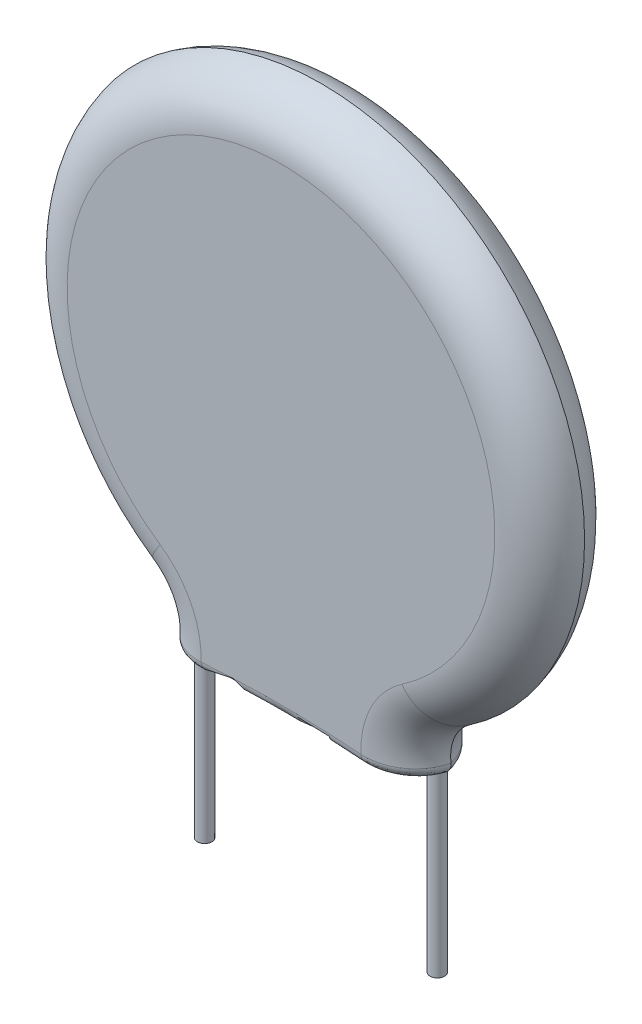
from build123d import *

# Parameters (mm, degrees)
BOSS_EXTRUDE1_DEPTH = 1.375
FILLET1_R           = 1.75
FILLET7_R           = 0.35
WRAP1_START         = -0.01
WRAP1_DEPTH         = 0.01


# Read off the part's stored shape, not the designer's step: Wrap1
with BuildPart() as part:
    # Sketch1 → Boss-Extrude1 (new, symmetric)
    with BuildSketch(Plane.XY):
        with BuildLine():
            ThreePointArc((4.65, -9.4), (4.54361032, -8.36096623), (5.144221582, -7.506462836))
            ThreePointArc((5.144221582, -7.506462836), (0, 9.1), (-5.144221582, -7.506462836))
            ThreePointArc((-5.144221582, -7.506462836), (-4.54361032, -8.36096623), (-4.65, -9.4))
            ThreePointArc((-4.65, -9.4), (0, -9.1), (4.65, -9.4))
        make_face()
    extrude(amount=BOSS_EXTRUDE1_DEPTH, both=True)

    # Fillet1
    # the kernel refuses this fillet: 1.75 mm, written as the material it takes off along each edge
    with BuildSketch(Plane(origin=(-5.988209995, -8.738013141, -1.375), x_dir=(0.5652990749851068, 0.8248860259581214, 0), z_dir=(-0.8248860259581214, 0.5652990749851068, 0))) as fillet1_piece_1:
        with BuildLine():
            CenterArc((1.492994505 + FILLET1_R, -FILLET1_R), FILLET1_R, 90, 90)
            Line((1.492994505 + FILLET1_R, 0), (1.492994505, 0))
            Line((1.492994505, 0), (1.492994505, -FILLET1_R))
        make_face()
    revolve(axis=Axis((-5.988209995, -8.738013141, -1.375), (0, 0, -1)), revolution_arc=249.850328298, mode=Mode.SUBTRACT)
    with BuildSketch(Plane(origin=(0, 0, -1.375), x_dir=(0.5652990749851083, -0.8248860259581203, 0), z_dir=(-0.8248860259581203, -0.5652990749851083, 0))) as fillet1_piece_2:
        with BuildLine():
            CenterArc((9.1 - FILLET1_R, FILLET1_R), FILLET1_R, 270, 90)
            Line((9.1 - FILLET1_R, 0), (9.1, 0))
            Line((9.1, 0), (9.1, FILLET1_R))
        make_face()
    revolve(axis=Axis((0, 0, -1.375), (0, 0, 1)), revolution_arc=291.153875626, mode=Mode.SUBTRACT)
    with BuildSketch(Plane(origin=(-5.988209995, -8.738013141, 1.375), x_dir=(0.5652990749851068, 0.8248860259581214, 0), z_dir=(-0.8248860259581214, 0.5652990749851068, 0))) as fillet1_piece_3:
        with BuildLine():
            CenterArc((1.492994505 + FILLET1_R, FILLET1_R), FILLET1_R, 180, 90)
            Line((1.492994505 + FILLET1_R, 0), (1.492994505, 0))
            Line((1.492994505, 0), (1.492994505, FILLET1_R))
        make_face()
    revolve(axis=Axis((-5.988209995, -8.738013141, 1.375), (0, 0, -1)), revolution_arc=249.850328298, mode=Mode.SUBTRACT)
    with BuildSketch(Plane(origin=(0, 0, 1.375), x_dir=(0.5652990749851083, -0.8248860259581203, 0), z_dir=(-0.8248860259581203, -0.5652990749851083, 0))) as fillet1_piece_4:
        with BuildLine():
            CenterArc((9.1 - FILLET1_R, -FILLET1_R), FILLET1_R, 0, 90)
            Line((9.1 - FILLET1_R, 0), (9.1, 0))
            Line((9.1, 0), (9.1, -FILLET1_R))
        make_face()
    revolve(axis=Axis((0, 0, 1.375), (0, 0, 1)), revolution_arc=291.153875626, mode=Mode.SUBTRACT)
    with BuildSketch(Plane(origin=(5.988209995, -8.738013141, -1.375), x_dir=(0.9691303390845691, 0.24654895227079748, 0), z_dir=(-0.24654895227079748, 0.9691303390845691, 0))) as fillet1_piece_5:
        with BuildLine():
            CenterArc((1.492994505 + FILLET1_R, -FILLET1_R), FILLET1_R, 90, 90)
            Line((1.492994505 + FILLET1_R, 0), (1.492994505, 0))
            Line((1.492994505, 0), (1.492994505, -FILLET1_R))
        make_face()
    revolve(axis=Axis((5.988209995, -8.738013141, -1.375), (0, 0, -1)), revolution_arc=249.850328298, mode=Mode.SUBTRACT)
    with BuildSketch(Plane(origin=(5.988209995, -8.738013141, 1.375), x_dir=(0.9691303390845691, 0.24654895227079748, 0), z_dir=(-0.24654895227079748, 0.9691303390845691, 0))) as fillet1_piece_6:
        with BuildLine():
            CenterArc((1.492994505 + FILLET1_R, FILLET1_R), FILLET1_R, 180, 90)
            Line((1.492994505, FILLET1_R), (1.492994505, 0))
            Line((1.492994505, 0), (1.492994505 + FILLET1_R, 0))
        make_face()
    revolve(axis=Axis((5.988209995, -8.738013141, 1.375), (0, 0, -1)), revolution_arc=249.850328298, mode=Mode.SUBTRACT)

    # Fillet7
    fillet7_edges = [part.edges().sort_by_distance(p)[0] for p in [
        (0, -9.1, -1.375),
        (0, -9.1, 1.375),
        (3.918729767, -9.312804543, 0.989952098),
        (3.918729762, -9.312804542, -0.989952103),
        (-3.918729767, -9.312804543, 0.989952098),
        (-3.918729762, -9.312804542, -0.989952103),
    ]]
    fillet(fillet7_edges, radius=FILLET7_R)

    # Wrap1 outline → Wrap1 (cut)
    # profile 1 of 7: a face of its own
    with BuildSketch(Plane(origin=(0, 0, -1.375), x_dir=(-1, 0, 0), z_dir=(0, 0, -1)).offset(WRAP1_START)):
        with BuildLine():
            Line((-3.405877976, 1.0390625), (-3.506324405, 0.931547619))
            add(Edge.make_bspline(
                [(-3.506324405, 0.931547619), (-3.510771743, 0.924253302), (-3.52084471, 0.907732087), (-3.522747076, 0.888400579), (-3.523809524, 0.877604167)],
                knots=[0, 0, 0, 0, 0.441512162, 1, 1, 1, 1], degree=3))
            Line((-3.523809524, 0.877604167), (-3.5234375, 0.857886905))
            add(Edge.make_bspline(
                [(-3.5234375, 0.857886905), (-3.518094179, 0.844321571), (-3.506013831, 0.813652635), (-3.474209827, 0.803359419), (-3.456473214, 0.797619048)],
                knots=[0, 0, 0, 0, 0.442315111, 1, 1, 1, 1], degree=3))
            Line((-3.456473214, 0.797619048), (-2.642857143, 0.797619048))
            Line((-2.642857143, 0.797619048), (-2.642857143, 0.272693452))
            add(Edge.make_bspline(
                [(-2.642857143, 0.272693452), (-2.639234132, 0.253384522), (-2.630990314, 0.209448877), (-2.585193656, 0.20491966), (-2.55952381, 0.202380952)],
                knots=[0, 0, 0, 0, 0.439482114, 1, 1, 1, 1], degree=3))
            add(Edge.make_bspline(
                [(-2.55952381, 0.202380952), (-2.539318487, 0.205000694), (-2.494231769, 0.210846458), (-2.467263542, 0.248063001), (-2.452380952, 0.26860119)],
                knots=[0, 0, 0, 0, 0.448143547, 1, 1, 1, 1], degree=3))
            Line((-2.452380952, 0.26860119), (-2.452380952, 0.797619048))
            Line((-2.452380952, 0.797619048), (-2.09858631, 0.797619048))
            Line((-2.09858631, 0.797619048), (-2.059151786, 0.813616071))
            add(Edge.make_bspline(
                [(-2.059151786, 0.813616071), (-2.048705584, 0.823203954), (-2.024997845, 0.844963728), (-2.022088646, 0.877346929), (-2.02046131, 0.89546131)],
                knots=[0, 0, 0, 0, 0.440624151, 1, 1, 1, 1], degree=3))
            add(Edge.make_bspline(
                [(-2.02046131, 0.89546131), (-2.026538921, 0.912107085), (-2.040424791, 0.950138649), (-2.080748128, 0.958955709), (-2.103422619, 0.96391369)],
                knots=[0, 0, 0, 0, 0.43768318, 1, 1, 1, 1], degree=3))
            Line((-2.103422619, 0.96391369), (-2.452380952, 0.964285714))
            Line((-2.452380952, 0.964285714), (-2.452380952, 2.12983631))
            Line((-2.452380952, 2.12983631), (-2.464285714, 2.157738095))
            add(Edge.make_bspline(
                [(-2.464285714, 2.157738095), (-2.471912668, 2.167725264), (-2.489394952, 2.190617562), (-2.518064332, 2.195761123), (-2.53422619, 2.198660714)],
                knots=[0, 0, 0, 0, 0.436267614, 1, 1, 1, 1], degree=3))
            add(Edge.make_bspline(
                [(-2.53422619, 2.198660714), (-2.537397116, 2.199492453), (-2.54459904, 2.20138153), (-2.552021282, 2.202022304), (-2.556175595, 2.202380952)],
                knots=[0, 0, 0, 0, 0.440288683, 1, 1, 1, 1], degree=3))
            add(Edge.make_bspline(
                [(-2.556175595, 2.202380952), (-2.565494264, 2.201082535), (-2.586693412, 2.19812875), (-2.604328314, 2.185833812), (-2.61421131, 2.178943452)],
                knots=[0, 0, 0, 0, 0.439577531, 1, 1, 1, 1], degree=3))
            Line((-2.61421131, 2.178943452), (-3.405877976, 1.0390625))
        make_face()
        Polygon((-2.642857143, 1.921875), (-2.642857143, 0.964285714), (-3.287574405, 0.964285714), align=None, mode=Mode.SUBTRACT)
    # profile 2 of 7: a face of its own
    with BuildSketch(Plane(origin=(0, 0, -1.375), x_dir=(-1, 0, 0), z_dir=(0, 0, -1)).offset(WRAP1_START)):
        with BuildLine():
            Line((0.928571429, -0.395089286), (1.640997024, -2.248139881))
            add(Edge.make_bspline(
                [(1.640997024, -2.248139881), (1.647308346, -2.260858798), (1.66156507, -2.289589717), (1.693746528, -2.294745617), (1.711681548, -2.297619048)],
                knots=[0, 0, 0, 0, 0.44269091, 1, 1, 1, 1], degree=3))
            add(Edge.make_bspline(
                [(1.711681548, -2.297619048), (1.72906646, -2.296816711), (1.768297032, -2.295006168), (1.795972668, -2.26657566), (1.811383929, -2.250744048)],
                knots=[0, 0, 0, 0, 0.443147037, 1, 1, 1, 1], degree=3))
            Line((1.811383929, -2.250744048), (2.523809524, -0.389136905))
            add(Edge.make_bspline(
                [(2.523809524, -0.389136905), (2.52360421, -0.382404249), (2.523138145, -0.367121051), (2.519036072, -0.352373106), (2.516741071, -0.344122024)],
                knots=[0, 0, 0, 0, 0.44052667, 1, 1, 1, 1], degree=3))
            add(Edge.make_bspline(
                [(2.516741071, -0.344122024), (2.505579268, -0.332673805), (2.4801106, -0.306551605), (2.443774609, -0.300832), (2.423363095, -0.297619048)],
                knots=[0, 0, 0, 0, 0.438256296, 1, 1, 1, 1], degree=3))
            add(Edge.make_bspline(
                [(2.423363095, -0.297619048), (2.411382539, -0.300012814), (2.384263898, -0.305431236), (2.364709974, -0.32524766), (2.353794643, -0.336309524)],
                knots=[0, 0, 0, 0, 0.441783061, 1, 1, 1, 1], degree=3))
            Line((2.353794643, -0.336309524), (1.725074405, -2.045386905))
            Line((1.725074405, -2.045386905), (1.102678571, -0.345610119))
            add(Edge.make_bspline(
                [(1.102678571, -0.345610119), (1.091119569, -0.334433258), (1.064831844, -0.309014607), (1.028764617, -0.301711114), (1.008556548, -0.297619048)],
                knots=[0, 0, 0, 0, 0.43971102, 1, 1, 1, 1], degree=3))
            add(Edge.make_bspline(
                [(1.008556548, -0.297619048), (0.998432776, -0.299407741), (0.975385693, -0.303479756), (0.956593816, -0.317601996), (0.946056548, -0.325520833)],
                knots=[0, 0, 0, 0, 0.439264753, 1, 1, 1, 1], degree=3))
            add(Edge.make_bspline(
                [(0.946056548, -0.325520833), (0.940937244, -0.334997611), (0.929270063, -0.356595722), (0.928822571, -0.381251771), (0.928571429, -0.395089286)],
                knots=[0, 0, 0, 0, 0.438778094, 1, 1, 1, 1], degree=3))
        make_face()
    # profile 3 of 7: a face of its own
    with BuildSketch(Plane(origin=(0, 0, -1.375), x_dir=(-1, 0, 0), z_dir=(0, 0, -1)).offset(WRAP1_START)):
        with BuildLine():
            Line((-0.785714286, -1.449032738), (-0.785714286, -0.366815476))
            add(Edge.make_bspline(
                [(-0.785714286, -0.366815476), (-0.79519786, -0.348256433), (-0.81696731, -0.305654339), (-0.865478958, -0.300517877), (-0.892857143, -0.297619048)],
                knots=[0, 0, 0, 0, 0.435636873, 1, 1, 1, 1], degree=3))
            add(Edge.make_bspline(
                [(-0.892857143, -0.297619048), (-0.911346879, -0.298688184), (-0.95268093, -0.301078252), (-0.967822244, -0.340541064), (-0.976190476, -0.36235119)],
                knots=[0, 0, 0, 0, 0.447324562, 1, 1, 1, 1], degree=3))
            Line((-0.976190476, -0.36235119), (-0.976190476, -2.226190476))
            add(Edge.make_bspline(
                [(-0.976190476, -2.226190476), (-0.971803093, -2.24485099), (-0.961827502, -2.287279393), (-0.917621065, -2.293906577), (-0.892857143, -2.297619048)],
                knots=[0, 0, 0, 0, 0.439811847, 1, 1, 1, 1], degree=3))
            Line((-0.892857143, -2.297619048), (-0.858630952, -2.297619048))
            add(Edge.make_bspline(
                [(-0.858630952, -2.297619048), (-0.844546159, -2.291434274), (-0.812777933, -2.277484526), (-0.795391983, -2.247161639), (-0.785714286, -2.230282738)],
                knots=[0, 0, 0, 0, 0.443361007, 1, 1, 1, 1], degree=3))
            Line((-0.785714286, -2.230282738), (-0.785714286, -1.632440476))
            Line((-0.785714286, -1.632440476), (-0.450892857, -1.27827381))
            Line((-0.450892857, -1.27827381), (0.269717262, -2.261904762))
            add(Edge.make_bspline(
                [(0.269717262, -2.261904762), (0.27971902, -2.271965965), (0.302506095, -2.294888472), (0.335122363, -2.296637633), (0.353422619, -2.297619048)],
                knots=[0, 0, 0, 0, 0.438922434, 1, 1, 1, 1], degree=3))
            add(Edge.make_bspline(
                [(0.353422619, -2.297619048), (0.373175408, -2.293671513), (0.417098243, -2.284893668), (0.431698081, -2.241748217), (0.439732143, -2.218005952)],
                knots=[0, 0, 0, 0, 0.449715703, 1, 1, 1, 1], degree=3))
            add(Edge.make_bspline(
                [(0.439732143, -2.218005952), (0.438538582, -2.21290242), (0.435827168, -2.201308713), (0.430221432, -2.190786297), (0.427083333, -2.184895833)],
                knots=[0, 0, 0, 0, 0.440198566, 1, 1, 1, 1], degree=3))
            Line((0.427083333, -2.184895833), (-0.335193452, -1.171502976))
            Line((-0.335193452, -1.171502976), (0.366071429, -0.474702381))
            Line((0.366071429, -0.474702381), (0.42671131, -0.411830357))
            add(Edge.make_bspline(
                [(0.42671131, -0.411830357), (0.429907307, -0.407239301), (0.437135694, -0.396855711), (0.438802376, -0.384259178), (0.439732143, -0.377232143)],
                knots=[0, 0, 0, 0, 0.442145323, 1, 1, 1, 1], degree=3))
            add(Edge.make_bspline(
                [(0.439732143, -0.377232143), (0.438690898, -0.370352545), (0.436322271, -0.354702812), (0.428732491, -0.340769538), (0.424479167, -0.33296131)],
                knots=[0, 0, 0, 0, 0.439598435, 1, 1, 1, 1], degree=3))
            add(Edge.make_bspline(
                [(0.424479167, -0.33296131), (0.415672627, -0.324532905), (0.395634579, -0.305355252), (0.36810766, -0.300636163), (0.352678571, -0.297991071)],
                knots=[0, 0, 0, 0, 0.439490913, 1, 1, 1, 1], degree=3))
            add(Edge.make_bspline(
                [(0.352678571, -0.297991071), (0.342905489, -0.297906513), (0.320798852, -0.297715242), (0.300427769, -0.306488965), (0.2890625, -0.311383929)],
                knots=[0, 0, 0, 0, 0.442088143, 1, 1, 1, 1], degree=3))
            Line((0.2890625, -0.311383929), (-0.785714286, -1.449032738))
        make_face()
    # profile 4 of 7: a face of its own
    with BuildSketch(Plane(origin=(0, 0, -1.375), x_dir=(-1, 0, 0), z_dir=(0, 0, -1)).offset(WRAP1_START)):
        with BuildLine():
            add(Edge.make_bspline(
                [(-1.714285714, 2.119047619), (-1.714302628, 2.114377128), (-1.714340963, 2.103791262), (-1.711680254, 2.09353103), (-1.710193452, 2.087797619)],
                knots=[0, 0, 0, 0, 0.441200688, 1, 1, 1, 1], degree=3))
            add(Edge.make_bspline(
                [(-1.710193452, 2.087797619), (-1.705490813, 2.07579409), (-1.694818488, 2.048552888), (-1.66626778, 2.040319644), (-1.650297619, 2.035714286)],
                knots=[0, 0, 0, 0, 0.440638716, 1, 1, 1, 1], degree=3))
            Line((-1.650297619, 2.035714286), (-0.516369048, 2.035714286))
            Line((-0.516369048, 2.035714286), (-1.363095238, 0.297619048))
            add(Edge.make_bspline(
                [(-1.363095238, 0.297619048), (-1.363153051, 0.29001818), (-1.363284013, 0.272800044), (-1.358388932, 0.256261493), (-1.355654762, 0.24702381)],
                knots=[0, 0, 0, 0, 0.441445415, 1, 1, 1, 1], degree=3))
            add(Edge.make_bspline(
                [(-1.355654762, 0.24702381), (-1.348370683, 0.235547151), (-1.331887873, 0.209577143), (-1.301059098, 0.204958517), (-1.283854167, 0.202380952)],
                knots=[0, 0, 0, 0, 0.441919713, 1, 1, 1, 1], degree=3))
            add(Edge.make_bspline(
                [(-1.283854167, 0.202380952), (-1.268239841, 0.202576117), (-1.23320466, 0.203014024), (-1.208108076, 0.227977572), (-1.194196429, 0.241815476)],
                knots=[0, 0, 0, 0, 0.445675624, 1, 1, 1, 1], degree=3))
            Line((-1.194196429, 0.241815476), (-0.383556548, 2.083333333))
            add(Edge.make_bspline(
                [(-0.383556548, 2.083333333), (-0.372977533, 2.088884466), (-0.348936754, 2.101499399), (-0.323909807, 2.112033129), (-0.309895833, 2.117931548)],
                knots=[0, 0, 0, 0, 0.440044614, 1, 1, 1, 1], degree=3))
            add(Edge.make_bspline(
                [(-0.309895833, 2.117931548), (-0.31078592, 2.12355604), (-0.312808992, 2.136339916), (-0.316903418, 2.148625583), (-0.319196429, 2.155505952)],
                knots=[0, 0, 0, 0, 0.439967736, 1, 1, 1, 1], degree=3))
            add(Edge.make_bspline(
                [(-0.319196429, 2.155505952), (-0.330889677, 2.167665899), (-0.357629512, 2.195472968), (-0.396360639, 2.199655439), (-0.418154762, 2.202008929)],
                knots=[0, 0, 0, 0, 0.437296954, 1, 1, 1, 1], degree=3))
            Line((-0.418154762, 2.202008929), (-1.643229167, 2.199404762))
            add(Edge.make_bspline(
                [(-1.643229167, 2.199404762), (-1.661682947, 2.19565972), (-1.703768051, 2.187118895), (-1.710503611, 2.143525736), (-1.714285714, 2.119047619)],
                knots=[0, 0, 0, 0, 0.438487212, 1, 1, 1, 1], degree=3))
        make_face()
    # profile 5 of 7: a face of its own
    with BuildSketch(Plane(origin=(0, 0, -1.375), x_dir=(-1, 0, 0), z_dir=(0, 0, -1)).offset(WRAP1_START)):
        with BuildLine():
            Line((0.285714286, 1.314732143), (0.285714286, 1.514136905))
            add(Edge.make_bspline(
                [(0.285714286, 1.514136905), (0.282288668, 1.523140345), (0.274456352, 1.543725771), (0.257853291, 1.558359105), (0.248511905, 1.566592262)],
                knots=[0, 0, 0, 0, 0.43736965, 1, 1, 1, 1], degree=3))
            add(Edge.make_bspline(
                [(0.248511905, 1.566592262), (0.238932661, 1.57156837), (0.217114675, 1.582902109), (0.192422461, 1.583178367), (0.178571429, 1.583333333)],
                knots=[0, 0, 0, 0, 0.439052626, 1, 1, 1, 1], degree=3))
            add(Edge.make_bspline(
                [(0.178571429, 1.583333333), (0.160081692, 1.582264197), (0.118747641, 1.579874129), (0.103606327, 1.540411317), (0.095238095, 1.51860119)],
                knots=[0, 0, 0, 0, 0.447324562, 1, 1, 1, 1], degree=3))
            Line((0.095238095, 1.51860119), (0.095238095, 0.273809524))
            add(Edge.make_bspline(
                [(0.095238095, 0.273809524), (0.099625478, 0.25514901), (0.109601069, 0.212720607), (0.153807506, 0.206093423), (0.178571429, 0.202380952)],
                knots=[0, 0, 0, 0, 0.439811847, 1, 1, 1, 1], degree=3))
            Line((0.178571429, 0.202380952), (0.212797619, 0.202380952))
            add(Edge.make_bspline(
                [(0.212797619, 0.202380952), (0.226717323, 0.208524845), (0.258125426, 0.222387784), (0.275846811, 0.252072432), (0.285714286, 0.26860119)],
                knots=[0, 0, 0, 0, 0.443188324, 1, 1, 1, 1], degree=3))
            Line((0.285714286, 0.26860119), (0.285714286, 1.123511905))
            Line((0.285714286, 1.123511905), (0.513020833, 1.347842262))
            Line((0.513020833, 1.347842262), (0.652529762, 1.416666667))
            Line((0.652529762, 1.416666667), (0.875, 1.416666667))
            Line((0.875, 1.416666667), (1.004092262, 1.352306548))
            Line((1.004092262, 1.352306548), (1.080357143, 1.141369048))
            Line((1.080357143, 1.141369048), (1.08296131, 0.27046131))
            add(Edge.make_bspline(
                [(1.08296131, 0.27046131), (1.090447465, 0.249964434), (1.107636184, 0.202902217), (1.159160163, 0.202569028), (1.188244048, 0.202380952)],
                knots=[0, 0, 0, 0, 0.435527199, 1, 1, 1, 1], degree=3))
            add(Edge.make_bspline(
                [(1.188244048, 0.202380952), (1.202714044, 0.206592228), (1.235009967, 0.215991471), (1.252099867, 0.245335904), (1.261532738, 0.261532738)],
                knots=[0, 0, 0, 0, 0.448044066, 1, 1, 1, 1], degree=3))
            Line((1.261532738, 0.261532738), (1.261904762, 1.163318452))
            add(Edge.make_bspline(
                [(1.261904762, 1.163318452), (1.248370667, 1.199921557), (1.217611879, 1.283109034), (1.188293228, 1.366815483), (1.171875, 1.413690476)],
                knots=[0, 0, 0, 0, 0.440007395, 1, 1, 1, 1], degree=3))
            add(Edge.make_bspline(
                [(1.171875, 1.413690476), (1.167997438, 1.427227358), (1.159191382, 1.457970007), (1.131067501, 1.473945747), (1.115327381, 1.482886905)],
                knots=[0, 0, 0, 0, 0.440329044, 1, 1, 1, 1], degree=3))
            Line((1.115327381, 1.482886905), (0.918526786, 1.579985119))
            Line((0.918526786, 1.579985119), (0.613839286, 1.58296131))
            Line((0.613839286, 1.58296131), (0.596354167, 1.578869048))
            Line((0.596354167, 1.578869048), (0.3984375, 1.483630952))
            Line((0.3984375, 1.483630952), (0.285714286, 1.314732143))
        make_face()
    # profile 6 of 7: a face of its own
    with BuildSketch(Plane(origin=(0, 0, -1.375), x_dir=(-1, 0, 0), z_dir=(0, 0, -1)).offset(WRAP1_START)):
        with BuildLine():
            Line((1.916666667, 0.202380952), (1.950892857, 0.202380952))
            add(Edge.make_bspline(
                [(1.950892857, 0.202380952), (1.964812561, 0.208524845), (1.996220664, 0.222387784), (2.013942049, 0.252072432), (2.023809524, 0.26860119)],
                knots=[0, 0, 0, 0, 0.443188324, 1, 1, 1, 1], degree=3))
            Line((2.023809524, 0.26860119), (2.023809524, 1.154761905))
            Line((2.023809524, 1.154761905), (2.62983631, 1.154761905))
            add(Edge.make_bspline(
                [(2.62983631, 1.154761905), (2.642909556, 1.15654097), (2.672634586, 1.160586082), (2.694323317, 1.181651603), (2.706473214, 1.193452381)],
                knots=[0, 0, 0, 0, 0.439805989, 1, 1, 1, 1], degree=3))
            add(Edge.make_bspline(
                [(2.706473214, 1.193452381), (2.710355516, 1.200153845), (2.719141393, 1.215319654), (2.721039078, 1.232802175), (2.722098214, 1.242559524)],
                knots=[0, 0, 0, 0, 0.441879805, 1, 1, 1, 1], degree=3))
            add(Edge.make_bspline(
                [(2.722098214, 1.242559524), (2.717481108, 1.259003585), (2.706905293, 1.29666989), (2.670459928, 1.312506043), (2.649925595, 1.321428571)],
                knots=[0, 0, 0, 0, 0.436572178, 1, 1, 1, 1], degree=3))
            Line((2.649925595, 1.321428571), (2.023809524, 1.321428571))
            Line((2.023809524, 1.321428571), (2.023809524, 2.035714286))
            Line((2.023809524, 2.035714286), (3.052455357, 2.035714286))
            add(Edge.make_bspline(
                [(3.052455357, 2.035714286), (3.063126766, 2.035645542), (3.087177718, 2.035490608), (3.108611887, 2.046630346), (3.120535714, 2.052827381)],
                knots=[0, 0, 0, 0, 0.443700072, 1, 1, 1, 1], degree=3))
            add(Edge.make_bspline(
                [(3.120535714, 2.052827381), (3.13115188, 2.062238387), (3.155219877, 2.083574157), (3.158744398, 2.115875208), (3.160714286, 2.133928571)],
                knots=[0, 0, 0, 0, 0.441090537, 1, 1, 1, 1], degree=3))
            add(Edge.make_bspline(
                [(3.160714286, 2.133928571), (3.154633366, 2.14847796), (3.140676199, 2.181872289), (3.105684092, 2.193080048), (3.0859375, 2.199404762)],
                knots=[0, 0, 0, 0, 0.435684404, 1, 1, 1, 1], degree=3))
            Line((3.0859375, 2.199404762), (1.899925595, 2.202380952))
            add(Edge.make_bspline(
                [(1.899925595, 2.202380952), (1.88676116, 2.198115428), (1.857049129, 2.188488173), (1.841816744, 2.160852509), (1.833333333, 2.14546131)],
                knots=[0, 0, 0, 0, 0.443067479, 1, 1, 1, 1], degree=3))
            Line((1.833333333, 2.14546131), (1.833333333, 0.273809524))
            add(Edge.make_bspline(
                [(1.833333333, 0.273809524), (1.837720716, 0.25514901), (1.847696307, 0.212720607), (1.891902744, 0.206093423), (1.916666667, 0.202380952)],
                knots=[0, 0, 0, 0, 0.439811847, 1, 1, 1, 1], degree=3))
        make_face()
    # profile 7 of 7: a face of its own
    with BuildSketch(Plane(origin=(0, 0, -1.375), x_dir=(-1, 0, 0), z_dir=(0, 0, -1)).offset(WRAP1_START)):
        with BuildLine():
            add(Edge.make_bspline(
                [(-2.436383929, -0.373511905), (-2.450984468, -0.380075262), (-2.484211886, -0.395011931), (-2.51030059, -0.420568908), (-2.524925595, -0.434895833)],
                knots=[0, 0, 0, 0, 0.439412387, 1, 1, 1, 1], degree=3))
            add(Edge.make_bspline(
                [(-2.524925595, -0.434895833), (-2.535772784, -0.445717274), (-2.560425115, -0.47031109), (-2.584172089, -0.495781424), (-2.597470238, -0.510044643)],
                knots=[0, 0, 0, 0, 0.440006596, 1, 1, 1, 1], degree=3))
            add(Edge.make_bspline(
                [(-2.597470238, -0.510044643), (-2.612340988, -0.539549008), (-2.646138089, -0.60660427), (-2.679329501, -0.673961531), (-2.697916667, -0.711681548)],
                knots=[0, 0, 0, 0, 0.440000746, 1, 1, 1, 1], degree=3))
            add(Edge.make_bspline(
                [(-2.697916667, -0.711681548), (-2.698074902, -0.719985221), (-2.698434518, -0.738856785), (-2.699771908, -0.757685353), (-2.700520833, -0.768229167)],
                knots=[0, 0, 0, 0, 0.44000979, 1, 1, 1, 1], degree=3))
            add(Edge.make_bspline(
                [(-2.700520833, -0.768229167), (-2.698565473, -0.771409619), (-2.694366004, -0.778240179), (-2.698377287, -0.785293404), (-2.700520833, -0.7890625)],
                knots=[0, 0, 0, 0, 0.465620921, 1, 1, 1, 1], degree=3))
            add(Edge.make_bspline(
                [(-2.700520833, -0.7890625), (-2.700289291, -0.804297833), (-2.699768115, -0.838590927), (-2.678491022, -0.865820206), (-2.666666667, -0.880952381)],
                knots=[0, 0, 0, 0, 0.444268247, 1, 1, 1, 1], degree=3))
            add(Edge.make_bspline(
                [(-2.666666667, -0.880952381), (-2.660057231, -0.88576297), (-2.644988912, -0.896730246), (-2.626230046, -0.897347145), (-2.615699405, -0.897693452)],
                knots=[0, 0, 0, 0, 0.438631212, 1, 1, 1, 1], degree=3))
            add(Edge.make_bspline(
                [(-2.615699405, -0.897693452), (-2.609389708, -0.897219283), (-2.595048852, -0.896141578), (-2.581100205, -0.892605355), (-2.57328869, -0.890625)],
                knots=[0, 0, 0, 0, 0.43998046, 1, 1, 1, 1], degree=3))
            add(Edge.make_bspline(
                [(-2.57328869, -0.890625), (-2.559226654, -0.882663353), (-2.527542564, -0.864724447), (-2.519406222, -0.828774435), (-2.514880952, -0.808779762)],
                knots=[0, 0, 0, 0, 0.443820123, 1, 1, 1, 1], degree=3))
            Line((-2.514880952, -0.808779762), (-2.514880952, -0.745907738))
            Line((-2.514880952, -0.745907738), (-2.440104167, -0.59672619))
            Line((-2.440104167, -0.59672619), (-2.377232143, -0.532738095))
            Line((-2.377232143, -0.532738095), (-2.240327381, -0.464285714))
            Line((-2.240327381, -0.464285714), (-1.935639881, -0.464285714))
            Line((-1.935639881, -0.464285714), (-1.78422619, -0.536830357))
            Line((-1.78422619, -0.536830357), (-1.718005952, -0.605282738))
            Line((-1.718005952, -0.605282738), (-1.642857143, -0.752604167))
            Line((-1.642857143, -0.752604167), (-1.642857143, -0.890997024))
            Line((-1.642857143, -0.890997024), (-1.71391369, -1.031994048))
            Line((-1.71391369, -1.031994048), (-1.884672619, -1.290550595))
            Line((-1.884672619, -1.290550595), (-2.755208333, -2.154017857))
            add(Edge.make_bspline(
                [(-2.755208333, -2.154017857), (-2.763092206, -2.16338521), (-2.780993745, -2.184655217), (-2.784020513, -2.212479937), (-2.785714286, -2.228050595)],
                knots=[0, 0, 0, 0, 0.440401981, 1, 1, 1, 1], degree=3))
            add(Edge.make_bspline(
                [(-2.785714286, -2.228050595), (-2.782857469, -2.242490297), (-2.77642174, -2.275019518), (-2.746054119, -2.289542698), (-2.729166667, -2.297619048)],
                knots=[0, 0, 0, 0, 0.443899416, 1, 1, 1, 1], degree=3))
            Line((-2.729166667, -2.297619048), (-1.465401786, -2.297619048))
            add(Edge.make_bspline(
                [(-1.465401786, -2.297619048), (-1.451559774, -2.296652241), (-1.420194557, -2.294461511), (-1.39740484, -2.272380771), (-1.384672619, -2.260044643)],
                knots=[0, 0, 0, 0, 0.441317253, 1, 1, 1, 1], degree=3))
            add(Edge.make_bspline(
                [(-1.384672619, -2.260044643), (-1.382212005, -2.253785945), (-1.376621693, -2.239566703), (-1.372720032, -2.224790316), (-1.370535714, -2.216517857)],
                knots=[0, 0, 0, 0, 0.440156891, 1, 1, 1, 1], degree=3))
            add(Edge.make_bspline(
                [(-1.370535714, -2.216517857), (-1.375121414, -2.197698768), (-1.38563463, -2.154553966), (-1.428316338, -2.139461659), (-1.452380952, -2.130952381)],
                knots=[0, 0, 0, 0, 0.436184375, 1, 1, 1, 1], degree=3))
            Line((-1.452380952, -2.130952381), (-2.522693452, -2.130952381))
            Line((-2.522693452, -2.130952381), (-1.742559524, -1.387276786))
            Line((-1.742559524, -1.387276786), (-1.550223214, -1.109747024))
            add(Edge.make_bspline(
                [(-1.550223214, -1.109747024), (-1.535815704, -1.081239215), (-1.5030713, -1.016448621), (-1.470577505, -0.951531957), (-1.452380952, -0.915178571)],
                knots=[0, 0, 0, 0, 0.439999186, 1, 1, 1, 1], degree=3))
            Line((-1.452380952, -0.915178571), (-1.452380952, -0.715401786))
            add(Edge.make_bspline(
                [(-1.452380952, -0.715401786), (-1.463087719, -0.693200298), (-1.487420625, -0.642743728), (-1.513131805, -0.592974401), (-1.527529762, -0.565104167)],
                knots=[0, 0, 0, 0, 0.440011819, 1, 1, 1, 1], degree=3))
            add(Edge.make_bspline(
                [(-1.527529762, -0.565104167), (-1.543528597, -0.538051202), (-1.580060725, -0.476277804), (-1.634313286, -0.4290658), (-1.664806548, -0.402529762)],
                knots=[0, 0, 0, 0, 0.437938763, 1, 1, 1, 1], degree=3))
            add(Edge.make_bspline(
                [(-1.664806548, -0.402529762), (-1.696643526, -0.387810818), (-1.768999448, -0.354359065), (-1.840764386, -0.319656482), (-1.880952381, -0.300223214)],
                knots=[0, 0, 0, 0, 0.440005163, 1, 1, 1, 1], degree=3))
            Line((-1.880952381, -0.300223214), (-2.26860119, -0.297619048))
            Line((-2.26860119, -0.297619048), (-2.287946429, -0.302083333))
            Line((-2.287946429, -0.302083333), (-2.436383929, -0.373511905))
        make_face()
    extrude(amount=WRAP1_DEPTH, mode=Mode.SUBTRACT)


with BuildPart() as body_2:
    # Sketch2 → Revolve1 (revolve)
    with BuildSketch(Plane.XY, mode=Mode.PRIVATE) as revolve1_sk:
        with BuildLine():
            Line((-4, -8.64379273), (-4, -15.39379273))
            Line((-4, -15.39379273), (-3.75, -15.39379273))
            Line((-3.75, -15.39379273), (-3.75, -8.88379273))
            ThreePointArc((-3.75, -8.88379273), (-3.820294373, -8.714087103), (-3.99, -8.64379273))
            Line((-3.99, -8.64379273), (-4, -8.64379273))
        make_face()
    revolve(revolve1_sk.sketch.rotate(Axis((-4, -8.64379273, 0), (0, -1, 0)), 180), axis=Axis((-4, -8.64379273, 0), (0, -1, 0)))


with BuildPart() as body_3:
    # Mirror2: mirrored copy
    add(body_2.part.mirror(Plane(origin=(0, 0, 0), x_dir=(0, 0, 1), z_dir=(1, 0, 0))))


solid = Compound([part.part, body_2.part, body_3.part])
